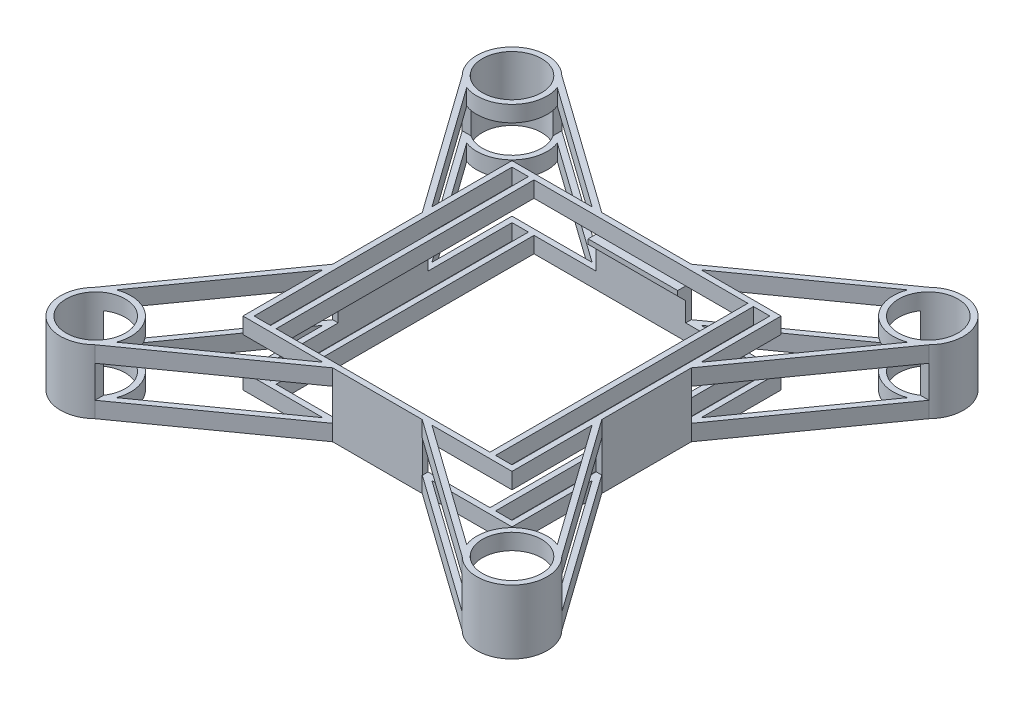
from build123d import *

# Parameters (mm, degrees)
SKETCH1_R               = 3.695
SKETCH1_W               = 2.05
SKETCH1_H               = 32.2
SKETCH1_W_2             = 26.7
BOSS_EXTRUDE1_DEPTH     = 8
CUT_EXTRUDE1_DEPTH      = 58.637669713
CUT_EXTRUDE1_DEPTH_BACK = 58.637669713
SKETCH2_W               = 17.334925969
SKETCH2_H               = 2
SKETCH2_W_2             = 11.186287382
CUT_EXTRUDE2_DEPTH      = 59.676664498
CUT_EXTRUDE2_DEPTH_BACK = 59.676664498
SKETCH5_W               = 45.85613932
SKETCH5_H               = 2
SKETCH6_W               = 0.7
SKETCH6_H               = 11.18952338
SKETCH6_W_2             = 11.219404543
SKETCH6_H_2             = 0.7
SKETCH6_H_3             = 11.186287382
SKETCH6_W_3             = 11.186287383
BOSS_EXTRUDE2_DEPTH     = 4
SKETCH7_W               = 11.186287383
SKETCH7_H               = 0.6
BOSS_EXTRUDE3_DEPTH     = 1
CHAMFER1_SIZE           = 1
SKETCH8_W               = 11.219404543
SKETCH8_H               = 0.6
BOSS_EXTRUDE4_DEPTH     = 1
CHAMFER2_SIZE           = 1
SKETCH9_W               = 0.999620658
SKETCH9_H               = 4
CUT_EXTRUDE3_DEPTH      = 0.999620658
CUT_EXTRUDE4_REACH      = 64.753
SKETCH10_W              = 0.999620658
SKETCH10_H              = 4
CUT_EXTRUDE5_REACH      = 64.753
SKETCH11_W              = 0.999620658
SKETCH11_H              = 4
CUT_EXTRUDE6_REACH      = 65.709
SKETCH12_W              = 0.999620658
SKETCH12_H              = 4


with BuildPart() as part:
    # Sketch1 → Boss-Extrude1 (new body)
    with BuildSketch(Plane(origin=(0, 0, 0), x_dir=(1, 0, 0), z_dir=(0, 1, 0))):
        with BuildLine():
            ThreePointArc((-26.486246099, 27.414111587), (-32.658298898, 27.371294009), (-32.701116476, 21.19924121))
            Line((-32.701116476, 21.19924121), (-20.928398332, 4.665158012))
            Line((-20.928398332, 4.665158012), (-20.358176439, 3.864315241))
            Line((-20.358176439, 3.864315241), (-20.358176439, -7.321972141))
            Line((-20.358176439, -7.321972141), (-20.928398332, -8.122814912))
            Line((-20.928398332, -8.122814912), (-32.701116476, -24.65689811))
            ThreePointArc((-32.701116476, -24.65689811), (-32.658298898, -30.828950909), (-26.486246099, -30.871768487))
            Line((-26.486246099, -30.871768487), (-9.952162901, -19.099050343))
            Line((-9.952162901, -19.099050343), (-9.151320131, -18.52882845))
            Line((-9.151320131, -18.52882845), (2.034967252, -18.52882845))
            Line((2.034967252, -18.52882845), (2.835810023, -19.099050343))
            Line((2.835810023, -19.099050343), (19.369893221, -30.871768487))
            ThreePointArc((19.369893221, -30.871768487), (25.54194602, -30.828950909), (25.584763598, -24.65689811))
            Line((25.584763598, -24.65689811), (13.812045453, -8.122814912))
            Line((13.812045453, -8.122814912), (13.241823561, -7.321972141))
            Line((13.241823561, -7.321972141), (13.241823561, 3.864315241))
            Line((13.241823561, 3.864315241), (13.812045453, 4.665158012))
            Line((13.812045453, 4.665158012), (25.584763598, 21.19924121))
            ThreePointArc((25.584763598, 21.19924121), (25.54194602, 27.371294009), (19.369893221, 27.414111587))
            Line((19.369893221, 27.414111587), (2.835810023, 15.641393443))
            Line((2.835810023, 15.641393443), (2.034967252, 15.07117155))
            Line((2.034967252, 15.07117155), (-9.151320131, 15.07117155))
            Line((-9.151320131, 15.07117155), (-9.952162901, 15.641393443))
            Line((-9.952162901, 15.641393443), (-26.486246099, 27.414111587))
        make_face()
        with Locations(Location((-29.550564595, -27.721216605, 0), (0, 0, 270))):
            Circle(SKETCH1_R, mode=Mode.SUBTRACT)
        with BuildLine():
            Line((-20.358176439, -8.52882845), (-20.358176439, -18.52882845))
            Line((-20.358176439, -18.52882845), (-10.358176439, -18.52882845))
            Line((-10.358176439, -18.52882845), (-25.435304322, -29.264154677))
            ThreePointArc((-25.435304322, -29.264154677), (-26.442830291, -24.613482302), (-31.093502666, -23.605956333))
            Line((-31.093502666, -23.605956333), (-20.358176439, -8.52882845))
        make_face(mode=Mode.SUBTRACT)
        with Locations((-18.633176439, -1.72882845)):
            Rectangle(SKETCH1_W, SKETCH1_H, mode=Mode.SUBTRACT)
        with Locations((-3.558176439, -1.72882845)):
            Rectangle(SKETCH1_W_2, SKETCH1_H, mode=Mode.SUBTRACT)
        with Locations(Location((22.434211716, -27.721216605, 0), (0, 0, 270))):
            Circle(SKETCH1_R, mode=Mode.SUBTRACT)
        with BuildLine():
            ThreePointArc((23.977149788, -23.605956333), (19.326477413, -24.613482302), (18.318951444, -29.264154677))
            Line((18.318951444, -29.264154677), (3.241823561, -18.52882845))
            Line((3.241823561, -18.52882845), (13.241823561, -18.52882845))
            Line((13.241823561, -18.52882845), (13.241823561, -8.52882845))
            Line((13.241823561, -8.52882845), (23.977149788, -23.605956333))
        make_face(mode=Mode.SUBTRACT)
        with Locations((11.516823561, -1.72882845)):
            Rectangle(SKETCH1_W, SKETCH1_H, mode=Mode.SUBTRACT)
        with BuildLine():
            Line((-10.358176439, 15.07117155), (-20.358176439, 15.07117155))
            Line((-20.358176439, 15.07117155), (-20.358176439, 5.07117155))
            Line((-20.358176439, 5.07117155), (-31.093502666, 20.148299433))
            ThreePointArc((-31.093502666, 20.148299433), (-26.442830291, 21.155825402), (-25.435304322, 25.806497777))
            Line((-25.435304322, 25.806497777), (-10.358176439, 15.07117155))
        make_face(mode=Mode.SUBTRACT)
        with Locations(Location((-29.550564595, 24.263559705, 0), (0, 0, 270))):
            Circle(SKETCH1_R, mode=Mode.SUBTRACT)
        with BuildLine():
            Line((13.241823561, 5.07117155), (13.241823561, 15.07117155))
            Line((13.241823561, 15.07117155), (3.241823561, 15.07117155))
            Line((3.241823561, 15.07117155), (18.318951444, 25.806497777))
            ThreePointArc((18.318951444, 25.806497777), (19.326477413, 21.155825402), (23.977149788, 20.148299433))
            Line((23.977149788, 20.148299433), (13.241823561, 5.07117155))
        make_face(mode=Mode.SUBTRACT)
        with Locations(Location((22.434211716, 24.263559705, 0), (0, 0, 270))):
            Circle(SKETCH1_R, mode=Mode.SUBTRACT)
    extrude(amount=BOSS_EXTRUDE1_DEPTH)

    # Sketch2 → Cut-Extrude1 (cut, two sides: drawn at the far end of the back side and taken through both)
    with BuildSketch(Plane.ZY.offset(20.358176439).offset(-CUT_EXTRUDE1_DEPTH_BACK)):
        with Locations((-12.531778226, 5)):
            Rectangle(SKETCH2_W, SKETCH2_H)
        with Locations((1.72882845, 5)):
            Rectangle(SKETCH2_W_2, SKETCH2_H)
        with Locations((15.989435126, 5)):
            Rectangle(SKETCH2_W, SKETCH2_H)
        with Locations((-12.531778226, 3)):
            Rectangle(SKETCH2_W, SKETCH2_H)
        with Locations((1.72882845, 3)):
            Rectangle(SKETCH2_W_2, SKETCH2_H)
        with Locations((15.989435126, 3)):
            Rectangle(SKETCH2_W, SKETCH2_H)
    extrude(amount=CUT_EXTRUDE1_DEPTH + CUT_EXTRUDE1_DEPTH_BACK, mode=Mode.SUBTRACT)

    # Sketch5 → Cut-Extrude2 (cut, two sides: drawn at the far end of the back side and taken through both)
    with BuildSketch(Plane(origin=(0, 0, -15.07117155), x_dir=(-1, 0, 0), z_dir=(0, 0, -1)).offset(-CUT_EXTRUDE2_DEPTH_BACK)):
        Polygon((-19.369893221, 6), (-19.369893221, 4), (26.486246099, 4), (26.486246099, 6), (9.151320131, 6), (-2.034967252, 6), align=None)
        with Locations((3.558176439, 3)):
            Rectangle(SKETCH5_W, SKETCH5_H)
    extrude(amount=CUT_EXTRUDE2_DEPTH + CUT_EXTRUDE2_DEPTH_BACK, mode=Mode.SUBTRACT)

    # Sketch6 → Boss-Extrude2 (add)
    with BuildSketch(Plane(origin=(0, 2, 0), x_dir=(1, 0, 0), z_dir=(0, 1, 0))):
        with Locations((-20.008176439, -1.730446449)):
            Rectangle(SKETCH6_W, SKETCH6_H)
        with Locations((-3.54161786, -18.17882845)):
            Rectangle(SKETCH6_W_2, SKETCH6_H_2)
        with Locations((12.891823561, -1.72882845)):
            Rectangle(SKETCH6_W, SKETCH6_H_3)
        with Locations((-3.55817644, 14.72117155)):
            Rectangle(SKETCH6_W_3, SKETCH6_H_2)
    extrude(amount=BOSS_EXTRUDE2_DEPTH)

    # Sketch7 → Boss-Extrude3 (add)
    with BuildSketch(Plane.XY.offset(-14.37117155)):
        with Locations((-3.55817644, 5.7)):
            Rectangle(SKETCH7_W, SKETCH7_H)
    extrude(amount=BOSS_EXTRUDE3_DEPTH)

    # Chamfer1
    chamfer1_edges = [part.edges().sort_by_distance(p)[0] for p in [
        (-3.558176439, 5.4, -14.37117155),
    ]]
    chamfer(chamfer1_edges, length=CHAMFER1_SIZE - 0.0001)  # a hair under: the kernel refuses the full size

    # Sketch8 → Boss-Extrude4 (add)
    with BuildSketch(Plane(origin=(0, 0, 17.82882845), x_dir=(-1, 0, 0), z_dir=(0, 0, -1))):
        with Locations((3.54161786, 5.7)):
            Rectangle(SKETCH8_W, SKETCH8_H)
    extrude(amount=BOSS_EXTRUDE4_DEPTH)

    # Chamfer2
    chamfer2_edges = [part.edges().sort_by_distance(p)[0] for p in [
        (-3.541617859, 5.4, 17.82882845),
    ]]
    chamfer(chamfer2_edges, length=CHAMFER2_SIZE - 0.0001)  # a hair under: the kernel refuses the full size

    # Sketch9 → Cut-Extrude3 (cut)
    with BuildSketch(Plane(origin=(0, 0, 24.65689811), x_dir=(-1, 0, 0), z_dir=(0, 0, -1))):
        with Locations((-19.86970355, 4)):
            Rectangle(SKETCH9_W, SKETCH9_H)
    extrude(amount=-CUT_EXTRUDE3_DEPTH, mode=Mode.SUBTRACT)

    # Sketch10 → Cut-Extrude4 (cut, up to next)
    with BuildSketch(Plane(origin=(-26.486246099, 0, 0), x_dir=(0, 0, -1), z_dir=(1, 0, 0)), mode=Mode.PRIVATE) as cut_extrude4_sk1:
        with Locations((-25.156708439, 4)):
            Rectangle(SKETCH10_W, SKETCH10_H)
    cut_extrude4_tool1 = extrude(cut_extrude4_sk1.sketch, amount=-CUT_EXTRUDE4_REACH, mode=Mode.PRIVATE) & part.part
    add(cut_extrude4_tool1.solids().sort_by_distance((-26.486246, 4, 25.156708))[0], mode=Mode.SUBTRACT)

    # Sketch11 → Cut-Extrude5 (cut, up to next)
    with BuildSketch(Plane(origin=(-26.486246099, 0, 0), x_dir=(0, 0, -1), z_dir=(1, 0, 0)), mode=Mode.PRIVATE) as cut_extrude5_sk1:
        with Locations((21.699051539, 4)):
            Rectangle(SKETCH11_W, SKETCH11_H)
    cut_extrude5_tool1 = extrude(cut_extrude5_sk1.sketch, amount=-CUT_EXTRUDE5_REACH, mode=Mode.PRIVATE) & part.part
    add(cut_extrude5_tool1.solids().sort_by_distance((-26.486246, 4, -21.699052))[0], mode=Mode.SUBTRACT)

    # Sketch12 → Cut-Extrude6 (cut, up to next)
    with BuildSketch(Plane.XY.offset(-21.19924121), mode=Mode.PRIVATE) as cut_extrude6_sk1:
        with Locations((19.86970355, 4)):
            Rectangle(SKETCH12_W, SKETCH12_H)
    cut_extrude6_tool1 = extrude(cut_extrude6_sk1.sketch, amount=-CUT_EXTRUDE6_REACH, mode=Mode.PRIVATE) & part.part
    add(cut_extrude6_tool1.solids().sort_by_distance((19.869704, 4, -21.199241))[0], mode=Mode.SUBTRACT)


solid = part.part
